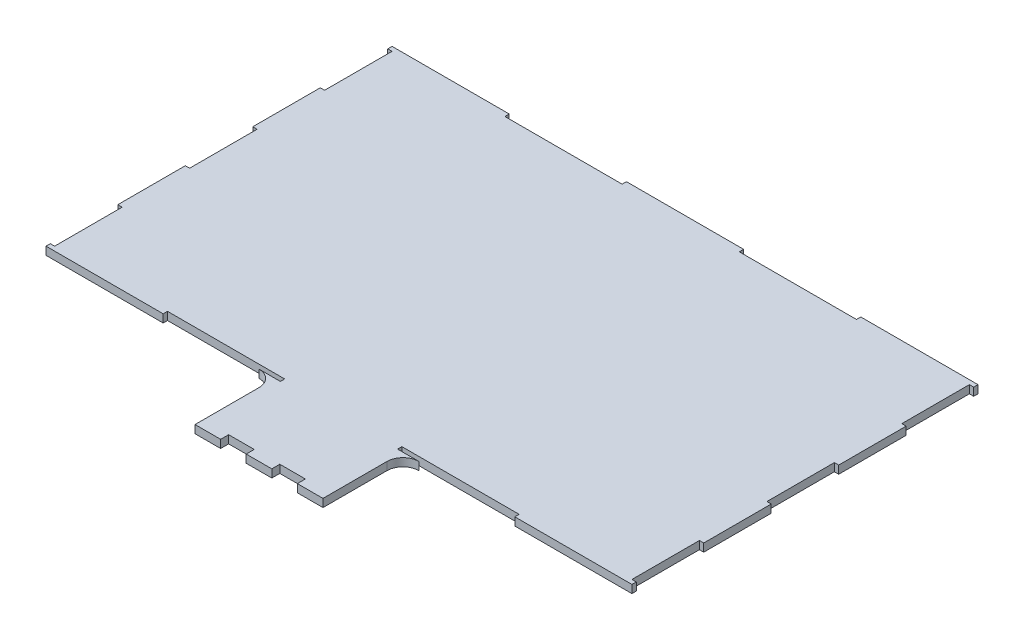
from build123d import *

# Parameters (mm, degrees)
BOSS_EXTRUDE1_DEPTH = 5


with BuildPart() as part:
    # Sketch1 → Boss-Extrude1 (new body)
    with BuildSketch(Plane(origin=(0, 0, 0), x_dir=(1, 0, 0), z_dir=(0, 1, 0))):
        with BuildLine():
            Line((-183.2, 108.2), (-109.92, 108.2))
            Line((-109.92, 108.2), (-109.92, 105.5))
            Line((-109.92, 105.5), (-36.64, 105.5))
            Line((-36.64, 105.5), (-36.64, 108.2))
            Line((-36.64, 108.2), (36.64, 108.2))
            Line((36.64, 108.2), (36.64, 105.5))
            Line((36.64, 105.5), (109.92, 105.5))
            Line((109.92, 105.5), (109.92, 108.2))
            Line((109.92, 108.2), (183.2, 108.2))
            Line((183.2, 108.2), (183.2, 105.5))
            Line((183.2, 105.5), (180.5, 105.5))
            Line((180.5, 105.5), (180.5, 63.3))
            Line((180.5, 63.3), (183.2, 63.3))
            Line((183.2, 63.3), (183.2, 21.1))
            Line((183.2, 21.1), (180.5, 21.1))
            Line((180.5, 21.1), (180.5, -21.1))
            Line((180.5, -21.1), (183.2, -21.1))
            Line((183.2, -21.1), (183.2, -63.3))
            Line((183.2, -63.3), (180.5, -63.3))
            Line((180.5, -63.3), (180.5, -105.5))
            Line((180.5, -105.5), (183.2, -105.5))
            Line((183.2, -105.5), (183.2, -108.2))
            Line((183.2, -108.2), (109.92, -108.2))
            Line((109.92, -108.2), (109.92, -105.5))
            Line((109.92, -105.5), (36.64, -105.5))
            Line((36.64, -105.5), (36.64, -108.2))
            Line((36.64, -108.2), (40, -108.2))
            Line((40, -108.2), (50, -108.2))
            ThreePointArc((50, -108.2), (42.928932188, -111.128932188), (40, -118.2))
            Line((40, -118.2), (40, -158.2))
            Line((40, -158.2), (24, -158.2))
            Line((24, -158.2), (24, -153.2))
            Line((24, -153.2), (8, -153.2))
            Line((8, -153.2), (8, -158.2))
            Line((8, -158.2), (-8, -158.2))
            Line((-8, -158.2), (-8, -153.2))
            Line((-8, -153.2), (-24, -153.2))
            Line((-24, -153.2), (-24, -158.2))
            Line((-24, -158.2), (-40, -158.2))
            Line((-40, -158.2), (-40, -118.2))
            ThreePointArc((-40, -118.2), (-42.928932188, -111.128932188), (-50, -108.2))
            Line((-50, -108.2), (-40, -108.2))
            Line((-40, -108.2), (-36.64, -108.2))
            Line((-36.64, -108.2), (-36.64, -105.5))
            Line((-36.64, -105.5), (-109.92, -105.5))
            Line((-109.92, -105.5), (-109.92, -108.2))
            Line((-109.92, -108.2), (-183.2, -108.2))
            Line((-183.2, -108.2), (-183.2, -105.5))
            Line((-183.2, -105.5), (-180.5, -105.5))
            Line((-180.5, -105.5), (-180.5, -63.3))
            Line((-180.5, -63.3), (-183.2, -63.3))
            Line((-183.2, -63.3), (-183.2, -21.1))
            Line((-183.2, -21.1), (-180.5, -21.1))
            Line((-180.5, -21.1), (-180.5, 21.1))
            Line((-180.5, 21.1), (-183.2, 21.1))
            Line((-183.2, 21.1), (-183.2, 63.3))
            Line((-183.2, 63.3), (-180.5, 63.3))
            Line((-180.5, 63.3), (-180.5, 105.5))
            Line((-180.5, 105.5), (-183.2, 105.5))
            Line((-183.2, 105.5), (-183.2, 108.2))
        make_face()
    extrude(amount=BOSS_EXTRUDE1_DEPTH)


solid = part.part
